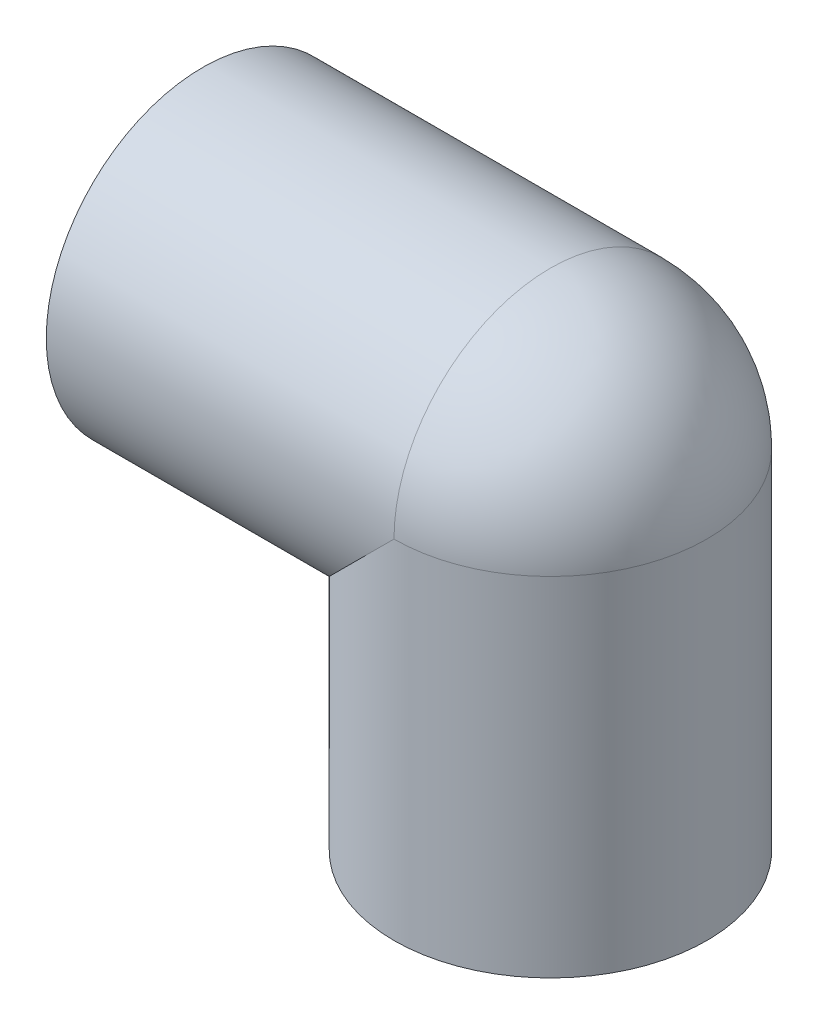
from build123d import *
from build123d.topology import SkipClean

# Parameters (mm, degrees)
SKETCH1_W    = 13.493749999999999
SKETCH1_H    = 2.676524999999998
SWEEP2_ANGLE = 180
SKETCH12_R   = 7.861299999999998
SKETCH12_2_R = 7.861299999999998
SKETCH16_R   = 7.861299999999998
SKETCH16_2_R = 7.861299999999998


# Read off the part's stored shape, not the designer's step: Sweep2
with BuildPart() as part:
    # Sketch1 → Revolve1 (revolve)
    with BuildSketch(Plane.XY, mode=Mode.PRIVATE) as revolve1_sk:
        with Locations((-17.065625, 9.3773625)):
            Rectangle(SKETCH1_W, SKETCH1_H)
    revolve(revolve1_sk.sketch.rotate(Axis((-34.18819835941514, 0, 0), (1, 0, 0)), 90), axis=Axis((-34.18819835941514, 0, 0), (1, 0, 0)))

    # Sketch2 → Revolve2 (revolve)
    with BuildSketch(Plane.XY, mode=Mode.PRIVATE) as revolve2_sk:
        Polygon((8.039100000000003, -10.31875), (10.715625000000001, -10.31875), (10.715625000000003, -23.8125), (8.039100000000003, -23.8125), align=None)
    revolve(revolve2_sk.sketch.rotate(Axis((0, 0, 0), (0, -1, 0)), 90), axis=Axis((0, 0, 0), (0, -1, 0)))

    # Sweep2 outline → Sweep2 (revolve)
    with SkipClean():  # the faces are left unmerged after this step: merging them gives an invalid solid
        with BuildSketch(Plane(origin=(0, 0, 0), x_dir=(0, 6e-17, -1), z_dir=(0, -1, -6e-17))):
            with BuildLine():
                Line((10.715625, -10.31875), (10.715625, 0))
                ThreePointArc((10.715625, 0), (7.577091102, 7.577091102), (0, 10.715625))
                Line((0, 10.715625), (0, 7.8613))
                ThreePointArc((0, 7.8613), (5.558778539, 5.558778539), (7.8613, 0))
                Line((7.8613, 0), (7.8613, -10.31875))
                Line((7.8613, -10.31875), (10.715625, -10.31875))
            make_face()
        revolve(axis=Axis((0, 0, 0), (1, 0, 0)), revolution_arc=SWEEP2_ANGLE)

    # Sweep3: sweep along a path in Sketch9
    with SkipClean():  # the faces are left unmerged after this step: merging them gives an invalid solid
        with BuildLine(Plane.XZ) as sweep3_path:
            CenterArc((0, 0), 10.715625, 0, 360)
        # Sketch8 → Sweep3 (sweep)
        with BuildSketch(Plane(origin=(0, 0, 0), x_dir=(0, 0, -1), z_dir=(1, 0, 0))):
            Polygon((-10.715625000000003, 7e-17), (-7.861299999999998, 0), (-7.861299999999998, -10.318750000000001), (-10.715625000000003, -10.318750000000001), align=None)
        sweep(path=sweep3_path.line)

    # Sweep4: sweep along a path in Sketch10
    with BuildLine(Plane(origin=(-10.318750000000001, 0, 0), x_dir=(0, 0, -1), z_dir=(1, 0, 0))) as sweep4_path:
        ThreePointArc((-10.715625, -3.87e-15), (6.6e-16, -10.715625), (10.715625, -3.87e-15))
    # Sketch11 → Sweep4 (sweep)
    with BuildSketch(Plane.XZ):
        Polygon((-10.318750000000001, 10.715625), (1.19e-15, 10.715625), (1.54e-15, 7.861299999999998), (-10.318750000000001, 7.861299999999998), align=None)
    sweep(path=sweep4_path.line)

    # Cut-Sweep3: sweep along a path in Sketch14
    with BuildLine(Plane.XY) as cut_sweep3_path:
        Line((1.73e-15, 8.039100000000001), (-10.318750000000001, 8.0391))
    # Sketch12 → Cut-Sweep3 (sweep, cut)
    with BuildSketch(Plane.ZY.offset(10.318750000000001)):
        Circle(SKETCH12_R)
    sweep(path=cut_sweep3_path.line, mode=Mode.SUBTRACT)

    # Cut-Sweep4: sweep along a path in Sketch15
    with BuildLine(Plane.XY) as cut_sweep4_path:
        Line((-10.318750000000001, 5.616092889966187), (-23.8125, 5.616092889966185))
    # Sketch12<2> → Cut-Sweep4 (sweep, cut)
    with BuildSketch(Plane.ZY.offset(10.318750000000001)):
        Circle(SKETCH12_2_R)
    sweep(path=cut_sweep4_path.line, mode=Mode.SUBTRACT)

    # Cut-Sweep6: sweep along a path in Sketch17
    with BuildLine(Plane.XY) as cut_sweep6_path:
        Line((7.861299999999998, 0), (7.861299999999998, -10.318750000000001))
    # Sketch16 → Cut-Sweep6 (sweep, cut)
    with BuildSketch(Plane.XZ.offset(10.318750000000001)):
        Circle(SKETCH16_R)
    sweep(path=cut_sweep6_path.line, mode=Mode.SUBTRACT)

    # Cut-Sweep7: sweep along a path in Sketch18
    with BuildLine(Plane.XY) as cut_sweep7_path:
        Line((-7.861299999999989, -10.318750000000001), (-7.8612999999999875, -23.8125))
    # Sketch16<2> → Cut-Sweep7 (sweep, cut)
    with BuildSketch(Plane.XZ.offset(10.318750000000001)):
        Circle(SKETCH16_2_R)
    sweep(path=cut_sweep7_path.line, mode=Mode.SUBTRACT)


solid = part.part
